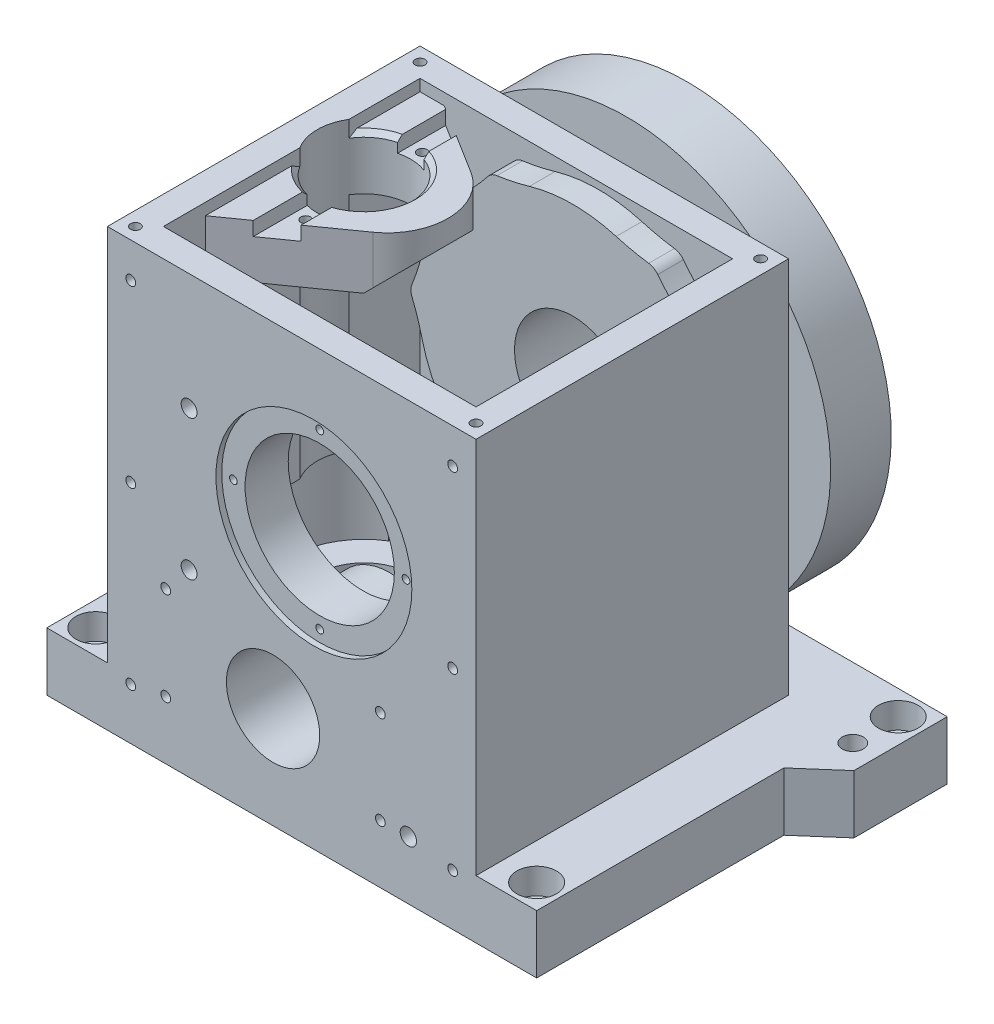
from build123d import *
from build123d.topology import SkipClean

# Parameters (mm, degrees)
SKETCH1_W             = 158
SKETCH1_H             = 187
EXTRUDE1_DEPTH        = 134
SHELL1_T              = -12
SKETCH2_R             = 87.5
EXTRUDE2_DEPTH        = 26
SKETCH3_R             = 82.5
EXTRUDE4_DEPTH        = 11
SKETCH4_R             = 75.5
EXTRUDE5_DEPTH        = 5
SKETCH5_R             = 57
EXTRUDE6_DEPTH        = 18
SKETCH6_R             = 25
EXTRUDE7_DEPTH        = 109
SKETCH8_R             = 32
EXTRUDE8_DEPTH        = 109
SKETCH41_R            = 41
SKETCH41_R_2          = 32
EXTRUDE42_DEPTH       = 9
SKETCH9_R             = 42
EXTRUDE9_DEPTH        = 2.5
CIRPATTERN7_COUNT     = 6
SKETCH10_R            = 20
EXTRUDE10_DEPTH       = 135.5
EXTRUDE12_DEPTH       = 25
EXTRUDE13_DEPTH       = 26
EXTRUDE14_DEPTH       = 45
CIRPATTERN1_COUNT     = 2
SKETCH16_R            = 4
EXTRUDE15_DEPTH       = 45
CIRPATTERN2_COUNT     = 6
SKETCH17_R            = 4
EXTRUDE16_DEPTH       = 21
SKETCH18_R            = 3
EXTRUDE17_DEPTH       = 9
CIRPATTERN3_COUNT     = 2
CIRPATTERN4_COUNT     = 2
EXTRUDE18_DEPTH       = 25
SKETCH20_R            = 8.5
EXTRUDE19_DEPTH       = 11
SKETCH21_R            = 5.5
SKETCH21_R_2          = 4.5
EXTRUDE20_DEPTH       = 255.945092128
EXTRUDE25_DEPTH       = 11
SKETCH23_R            = 20
EXTRUDE26_DEPTH       = 21
SKETCH24_R            = 25
EXTRUDE27_DEPTH       = 74
EXTRUDE28_DEPTH       = 23
EXTRUDE29_DEPTH       = 73
EXTRUDE36_DEPTH       = 74
EXTRUDE37_START       = -52
EXTRUDE37_DEPTH       = 52
EXTRUDE38_DEPTH       = 42
EXTRUDE39_DEPTH       = 154
SKETCH35_R            = 20
EXTRUDE35_DEPTH       = 239
SKETCH39_R            = 30
EXTRUDE40_DEPTH       = 7
EXTRUDE41_DEPTH       = 3
CHAMFER1_SIZE         = 3
SKETCH42_R            = 20
EXTRUDE43_DEPTH       = 38
SKETCH43_W            = 12
SKETCH43_H            = 82.49545063
EXTRUDE44_DEPTH       = 11
CUT_EXTRUDE1_START    = 50
SKETCH44_R            = 20
CUT_EXTRUDE1_DEPTH    = 50
CHAMFER2_SIZE         = 2
LPATTERN1_COUNT       = 2
LPATTERN1_PITCH       = 146
LPATTERN1_COUNT_DIR2  = 2
LPATTERN1_PITCH_DIR2  = 122
LPATTERN2_COUNT       = 3
LPATTERN2_PITCH       = 75
LPATTERN2_COUNT_DIR2  = 2
LPATTERN2_PITCH_DIR2  = 138
LPATTERN3_COUNT       = 2
LPATTERN3_PITCH       = 60
LPATTERN4_COUNT       = 2
LPATTERN4_PITCH       = 40
LPATTERN4_COUNT_DIR2  = 2
LPATTERN4_PITCH_DIR2  = 92
SKETCH52_R            = 3.5
CUT_EXTRUDE2_DEPTH    = 10
CIRPATTERN5_COUNT     = 4
CIRPATTERN6_COUNT     = 4
M5_TAPPED_HOLE6_D     = 4.2
M5_TAPPED_HOLE6_DEPTH = 34
M5_TAPPED_HOLE6_TIP   = 1.2618073
FILLET1_R             = 100
FILLET2_R             = 10
SKETCH62_R            = 8.5
CUT_EXTRUDE3_DEPTH    = 5
M5_TAPPED_HOLE9_D     = 4.2
M5_TAPPED_HOLE9_DEPTH = 52
M5_TAPPED_HOLE9_TIP   = 1.2618073


# Some blends are built 0.0001 mm under size
with BuildPart() as part:
    # Sketch1 → Extrude1 (new body)
    with BuildSketch(Plane.XY):
        Rectangle(SKETCH1_W, SKETCH1_H)
    extrude(amount=EXTRUDE1_DEPTH)

    # Shell1
    shell1_openings = [part.faces().sort_by_distance(p)[0] for p in [
        (0, 93.5, 67),
    ]]
    offset(amount=SHELL1_T, openings=shell1_openings, kind=Kind.INTERSECTION)

    # Sketch2 → Extrude2 (add)
    with BuildSketch(Plane(origin=(0, 0, 0), x_dir=(-1, 0, 0), z_dir=(0, 0, -1))):
        with Locations(Location((-9.5, 24, 0), (0, 0, 217.412158467))):
            Circle(SKETCH2_R)
    extrude(amount=EXTRUDE2_DEPTH)

    # Sketch3 → Extrude4 (cut)
    with BuildSketch(Plane(origin=(0, 0, -26), x_dir=(-1, 0, 0), z_dir=(0, 0, -1))):
        with Locations((-9.5, 24)):
            Circle(SKETCH3_R)
    extrude(amount=-EXTRUDE4_DEPTH, mode=Mode.SUBTRACT)

    # Sketch4 → Extrude5 (cut)
    with BuildSketch(Plane(origin=(0, 0, -15), x_dir=(-1, 0, 0), z_dir=(0, 0, -1))):
        with Locations((-9.5, 24)):
            Circle(SKETCH4_R)
    extrude(amount=-EXTRUDE5_DEPTH, mode=Mode.SUBTRACT)

    # Sketch5 → Extrude6 (add)
    with BuildSketch(Plane(origin=(0, 0, -10), x_dir=(-1, 0, 0), z_dir=(0, 0, -1))):
        with Locations((-9.5, 24)):
            Circle(SKETCH5_R)
    extrude(amount=EXTRUDE6_DEPTH)

    # Sketch6 → Extrude7 (cut)
    with BuildSketch(Plane(origin=(0, 0, -28), x_dir=(-1, 0, 0), z_dir=(0, 0, -1))):
        with Locations((-9.5, 24)):
            Circle(SKETCH6_R)
    extrude(amount=-EXTRUDE7_DEPTH, mode=Mode.SUBTRACT)

    # Sketch8 → Extrude8 (cut)
    with BuildSketch(Plane.XY.offset(134)):
        with Locations((9.5, 24)):
            Circle(SKETCH8_R)
    extrude(amount=-EXTRUDE8_DEPTH, mode=Mode.SUBTRACT)

    # Sketch41 → Extrude42 (add)
    with BuildSketch(Plane(origin=(0, 0, 122), x_dir=(-1, 0, 0), z_dir=(0, 0, -1))):
        with Locations(Location((-9.5, 24, 0), (0, 0, 180))):
            Circle(SKETCH41_R)
        with Locations(Location((-9.5, 24, 0), (0, 0, 180))):
            Circle(SKETCH41_R_2, mode=Mode.SUBTRACT)
    extrude(amount=EXTRUDE42_DEPTH)

    # Sketch9 → Extrude9 (cut)
    with BuildSketch(Plane.XY.offset(134)):
        with Locations((9.5, 24)):
            Circle(SKETCH9_R)
    extrude(amount=-EXTRUDE9_DEPTH, mode=Mode.SUBTRACT)

    # Sketch59 → M5 Tapped Hole7 (revolve, cut)
    with BuildSketch(Plane(origin=(72.9, 24, -10), x_dir=(0, 1, 0), z_dir=(1, 0, 0))):
        Polygon((0, 0), (0, 23.2618073), (2.1, 22), (2.1, 0), align=None)
    m5_tapped_hole7 = revolve(axis=Axis((72.9, 24, -16.35), (0, 0, 1)), mode=Mode.SUBTRACT)

    # CirPattern7: M5 Tapped Hole7 ×6 about axis
    cirpattern7_axis = Axis((9.5, 24, 0), (0, 0, 1))
    for i in range(1, CIRPATTERN7_COUNT):
        add(m5_tapped_hole7.rotate(cirpattern7_axis, i * 360 / CIRPATTERN7_COUNT), mode=Mode.SUBTRACT)

    # Sketch10 → Extrude10 (cut)
    with BuildSketch(Plane.XY.offset(134)):
        with Locations((-8, -50)):
            Circle(SKETCH10_R)
    extrude(amount=-EXTRUDE10_DEPTH, mode=Mode.SUBTRACT)

    # Sketch11 → Extrude12 (add)
    with BuildSketch(Plane.XZ.offset(93.5)):
        Polygon((105, 134), (79, 134), (79, 0), (-79, 0), (-79, 134), (-105, 134), (-105, -26), (105, -26), align=None)
    extrude(amount=-EXTRUDE12_DEPTH)

    # Sketch12 → Extrude13 (cut)
    with BuildSketch(Plane(origin=(0, 0, -26), x_dir=(-1, 0, 0), z_dir=(0, 0, -1))):
        with BuildLine():
            Line((-43.085711247, -67), (24.085711247, -67))
            ThreePointArc((24.085711247, -67), (-9.5, -73), (-43.085711247, -67))
        make_face()
    extrude(amount=-EXTRUDE13_DEPTH, mode=Mode.SUBTRACT)

    # Sketch13 → Extrude14 (cut)
    with BuildSketch(Plane(origin=(0, 0, -28), x_dir=(-1, 0, 0), z_dir=(0, 0, -1))):
        with BuildLine():
            Line((-56.5, 38.5), (-53.5, 38.5))
            Line((-53.5, 38.5), (-53.5, 32.366600265))
            ThreePointArc((-53.5, 32.366600265), (-55, 15.5), (-56.5, 32.366600265))
            Line((-56.5, 32.366600265), (-56.5, 38.5))
        make_face()
    extrude14 = extrude(amount=-EXTRUDE14_DEPTH, mode=Mode.SUBTRACT)

    # CirPattern1: Extrude14 ×2 about axis
    cirpattern1_axis = Axis((9.5, 24, 0), (0, 0, 1))
    for i in range(1, CIRPATTERN1_COUNT):
        add(extrude14.rotate(cirpattern1_axis, i * 360 / CIRPATTERN1_COUNT), mode=Mode.SUBTRACT)

    # Sketch16 → Extrude15 (cut)
    with BuildSketch(Plane(origin=(0, 0, -28), x_dir=(-1, 0, 0), z_dir=(0, 0, -1))):
        with Locations((-40.5, 24)):
            Circle(SKETCH16_R)
    extrude15 = extrude(amount=-EXTRUDE15_DEPTH, mode=Mode.SUBTRACT)

    # CirPattern2: Extrude15 ×6 about axis
    cirpattern2_axis = Axis((9.5, 24, 0), (0, 0, 1))
    for i in range(1, CIRPATTERN2_COUNT):
        add(extrude15.rotate(cirpattern2_axis, i * 360 / CIRPATTERN2_COUNT), mode=Mode.SUBTRACT)

    # Sketch17 → Extrude16 (cut)
    with BuildSketch(Plane(origin=(0, 0, -10), x_dir=(-1, 0, 0), z_dir=(0, 0, -1))):
        with Locations((-63.193575035, 55)):
            Circle(SKETCH17_R)
    extrude16 = extrude(amount=-EXTRUDE16_DEPTH, mode=Mode.SUBTRACT)

    # Sketch18 → Extrude17 (cut)
    with BuildSketch(Plane(origin=(0, 0, -10), x_dir=(-1, 0, 0), z_dir=(0, 0, -1))):
        with Locations((-63.193575035, -7)):
            Circle(SKETCH18_R)
    extrude17 = extrude(amount=-EXTRUDE17_DEPTH, mode=Mode.SUBTRACT)

    # CirPattern3: Extrude16 ×2 about axis
    cirpattern3_axis = Axis((9.5, 24, 0), (0, 0, 1))
    for i in range(1, CIRPATTERN3_COUNT):
        add(extrude16.rotate(cirpattern3_axis, i * 360 / CIRPATTERN3_COUNT), mode=Mode.SUBTRACT)

    # CirPattern4: Extrude17 ×2 about axis
    cirpattern4_axis = Axis((9.5, 24, 0), (0, 0, 1))
    for i in range(1, CIRPATTERN4_COUNT):
        add(extrude17.rotate(cirpattern4_axis, i * 360 / CIRPATTERN4_COUNT), mode=Mode.SUBTRACT)

    # Sketch19 → Extrude18 (add)
    with BuildSketch(Plane(origin=(0, -68.5, 0), x_dir=(1, 0, 0), z_dir=(0, 1, 0))):
        Polygon((105, -28), (105, 26), (121, 26), (121, -14), align=None)
    extrude(amount=-EXTRUDE18_DEPTH)

    # Sketch20 → Extrude19 (cut)
    with BuildSketch(Plane(origin=(0, -68.5, 0), x_dir=(1, 0, 0), z_dir=(0, 1, 0))):
        with Locations(Location((-94.5, -123.5, 0), (0, 0, 180))):
            Circle(SKETCH20_R)
        with Locations(Location((-94.5, 15.5, 0), (0, 0, 180))):
            Circle(SKETCH20_R)
        with Locations(Location((110.5, 15.5, 0), (0, 0, 180))):
            Circle(SKETCH20_R)
        with Locations(Location((94.5, -123.5, 0), (0, 0, 180))):
            Circle(SKETCH20_R)
    extrude(amount=-EXTRUDE19_DEPTH, mode=Mode.SUBTRACT)

    # Sketch21 → Extrude20 (cut, through all)
    with BuildSketch(Plane(origin=(0, -68.5, 0), x_dir=(1, 0, 0), z_dir=(0, 1, 0))):
        with Locations(Location((-94.5, 15.5, 0), (0, 0, 180))):
            Circle(SKETCH21_R)
        with Locations(Location((-94.5, -123.5, 0), (0, 0, 180))):
            Circle(SKETCH21_R)
        with Locations(Location((94.5, -123.5, 0), (0, 0, 180))):
            Circle(SKETCH21_R)
        with Locations(Location((110.5, 15.5, 0), (0, 0, 180))):
            Circle(SKETCH21_R)
        with Locations(Location((110.5, -4, 0), (0, 0, 180))):
            Circle(SKETCH21_R_2)
    extrude(amount=-EXTRUDE20_DEPTH, mode=Mode.SUBTRACT)

    # Sketch22 → Extrude25 (add)
    with BuildSketch(Plane.XY.offset(12)):
        with BuildLine():
            Line((67, 57.406586177), (67, -9.406586177))
            ThreePointArc((67, -9.406586177), (58.284474247, -21.192090817), (47.198716285, -30.781902034))
            ThreePointArc((47.198716285, -30.781902034), (44.2, -36.102163023), (38.093160687, -36.03899701))
            ThreePointArc((38.093160687, -36.03899701), (34.323305633, -37.693220839), (30.458315313, -39.111005532))
            ThreePointArc((30.458315313, -39.111005532), (29.992421312, -62.417251713), (16.604109764, -81.5))
            Line((16.604109764, -81.5), (-32.604109764, -81.5))
            ThreePointArc((-32.604109764, -81.5), (-47.830312702, -53.340420239), (-37.507091516, -23.038105268))
            ThreePointArc((-37.507091516, -23.038105268), (-50.878616002, -3.868848732), (-56.791876972, 18.742905025))
            ThreePointArc((-56.791876972, 18.742905025), (-59.9, 24), (-56.791876972, 29.257094975))
            ThreePointArc((-56.791876972, 29.257094975), (-48.090689352, 57.25), (-28.198716285, 78.781902034))
            ThreePointArc((-28.198716285, 78.781902034), (-25.2, 84.102163023), (-19.093160687, 84.03899701))
            ThreePointArc((-19.093160687, 84.03899701), (9.5, 90.5), (38.093160687, 84.03899701))
            ThreePointArc((38.093160687, 84.03899701), (44.2, 84.102163023), (47.198716285, 78.781902034))
            ThreePointArc((47.198716285, 78.781902034), (58.284474247, 69.192090817), (67, 57.406586177))
        make_face()
    extrude(amount=EXTRUDE25_DEPTH)

    # Sketch23 → Extrude26 (cut)
    with BuildSketch(Plane.XY.offset(23)):
        with Locations((-8, -50)):
            Circle(SKETCH23_R)
    extrude(amount=-EXTRUDE26_DEPTH, mode=Mode.SUBTRACT)

    # Sketch24 → Extrude27 (cut)
    with BuildSketch(Plane(origin=(0, 0, 12), x_dir=(-1, 0, 0), z_dir=(0, 0, -1))):
        with Locations((-9.5, 24)):
            Circle(SKETCH24_R)
    extrude(amount=-EXTRUDE27_DEPTH, mode=Mode.SUBTRACT)

    # Sketch25 → Extrude28 (add)
    with BuildSketch(Plane(origin=(0, 88.5, 0), x_dir=(-1, 0, 0), z_dir=(0, 1, 0))):
        with BuildLine():
            Line((67, 104), (24.967109486, 74.213491056))
            ThreePointArc((24.967109486, 74.213491056), (14.011240695, 52.235546082), (26.240002757, 30.939572174))
            Line((26.240002757, 30.939572174), (56.604475775, 12))
            Line((56.604475775, 12), (67, 12))
            Line((67, 12), (67, 42.464346247))
            ThreePointArc((67, 42.464346247), (30, 53), (67, 63.535653753))
            Line((67, 63.535653753), (67, 104))
        make_face()
    extrude(amount=-EXTRUDE28_DEPTH)

    # Sketch26 → Extrude29 (cut)
    with BuildSketch(Plane.XY.offset(97)):
        Polygon((-14.30151519, 78.5), (-44, 48.80151519), (-10.402265951, 48.80151519), (-10.402265951, 82.399249239), align=None)
    extrude(amount=-EXTRUDE29_DEPTH, mode=Mode.SUBTRACT)

    # Sketch28 → Extrude36 (add)
    with BuildSketch(Plane.XZ.offset(93.5)):
        with BuildLine():
            Line((-50, 83), (-79, 83))
            ThreePointArc((-79, 83), (-91.72529209, 53), (-79, 23))
            Line((-79, 23), (-50, 23))
            ThreePointArc((-50, 23), (-20, 53), (-50, 83))
        make_face()
    extrude(amount=-EXTRUDE36_DEPTH)

    # Sketch36 → Extrude37 (cut)
    with BuildSketch(Plane(origin=(0, -19.5, 0), x_dir=(1, 0, 0), z_dir=(0, 1, 0)).offset(EXTRUDE37_START)):
        with BuildLine():
            Line((-50, -23), (-67, -23))
            Line((-67, -23), (-67, -83))
            Line((-67, -83), (-50, -83))
            ThreePointArc((-50, -83), (-20, -53), (-50, -23))
        make_face()
    extrude(amount=EXTRUDE37_DEPTH, mode=Mode.SUBTRACT)

    # Sketch37 → Extrude38 (cut)
    with BuildSketch(Plane(origin=(0, -71.5, 0), x_dir=(1, 0, 0), z_dir=(0, 1, 0))):
        with BuildLine():
            Line((-50, -23), (-50, -83))
            Line((-50, -83), (-62.047272497, -83))
            ThreePointArc((-62.047272497, -83), (-82.328575202, -53), (-62.047272497, -23))
            Line((-62.047272497, -23), (-50, -23))
        make_face()
    extrude(amount=EXTRUDE38_DEPTH, mode=Mode.SUBTRACT)

    # Sketch38 → Extrude39 (cut)
    with BuildSketch(Plane.XY.offset(134)):
        Polygon((-79, -19.5), (-97.669801307, -38.169801307), (-97.669801307, -9.903731157), align=None)
    extrude(amount=-EXTRUDE39_DEPTH, mode=Mode.SUBTRACT)

    # Sketch35 → Extrude35 (cut)
    with SkipClean():  # the faces are left unmerged after this step: merging them gives an invalid solid
        with BuildSketch(Plane(origin=(0, 88.5, 0), x_dir=(1, 0, 0), z_dir=(0, 1, 0))):
            with Locations(Location((-50, -53, 0), (0, 0, 148.211669383))):
                Circle(SKETCH35_R)
        extrude(amount=-EXTRUDE35_DEPTH, mode=Mode.SUBTRACT)

    # Sketch39 → Extrude40 (cut)
    with SkipClean():  # the faces are left unmerged after this step: merging them gives an invalid solid
        with BuildSketch(Plane.XZ.offset(93.5)):
            with Locations((-50, 53)):
                Circle(SKETCH39_R)
        extrude(amount=-EXTRUDE40_DEPTH, mode=Mode.SUBTRACT)

    # Sketch40 → Extrude41 (cut)
    with SkipClean():  # the faces are left unmerged after this step: merging them gives an invalid solid
        with BuildSketch(Plane.XZ.offset(93.5)):
            with BuildLine():
                Line((-70, 117), (75, 117))
                Line((75, 117), (75, 7))
                Line((75, 7), (-50, 7))
                Line((-50, 7), (-50, 13))
                ThreePointArc((-50, 13), (-10, 53), (-50, 93))
                Line((-50, 93), (-70, 93))
                Line((-70, 93), (-70, 117))
            make_face()
        extrude(amount=-EXTRUDE41_DEPTH, mode=Mode.SUBTRACT)

    # Chamfer1
    chamfer1_edges = [part.edges().sort_by_distance(p)[0] for p in [
        (2.5, -90.5, 117),
        (75, -90.5, 62),
        (12.5, -90.5, 7),
        (-50, -90.5, 10),
        (-10, -90.5, 53),
        (-60, -90.5, 93),
        (-70, -90.5, 105),
    ]]
    chamfer(chamfer1_edges, length=CHAMFER1_SIZE - 0.0001)  # a hair under: the kernel refuses the full size

    # Sketch42 → Extrude43 (add)
    with BuildSketch(Plane(origin=(0, 0, 122), x_dir=(-1, 0, 0), z_dir=(0, 0, -1))):
        with BuildLine():
            Line((-17.5, -50), (-17.5, -81.5))
            Line((-17.5, -81.5), (33.5, -81.5))
            Line((33.5, -81.5), (33.5, -50))
            ThreePointArc((33.5, -50), (8, -24.5), (-17.5, -50))
        make_face()
        with Locations(Location((8, -50, 0), (0, 0, 180))):
            Circle(SKETCH42_R, mode=Mode.SUBTRACT)
    extrude(amount=EXTRUDE43_DEPTH)

    # Sketch43 → Extrude44 (cut)
    with BuildSketch(Plane(origin=(0, 93.5, 0), x_dir=(1, 0, 0), z_dir=(0, 1, 0))):
        with Locations((-49, -54.248502925)):
            Rectangle(SKETCH43_W, SKETCH43_H)
    extrude(amount=-EXTRUDE44_DEPTH, mode=Mode.SUBTRACT)

    # Sketch44 → Cut-Extrude1 (cut)
    with BuildSketch(Plane(origin=(0, 82.5, 0), x_dir=(1, 0, 0), z_dir=(0, 1, 0)).offset(CUT_EXTRUDE1_START)):
        with Locations(Location((-50, -53, 0), (0, 0, 180))):
            Circle(SKETCH44_R)
    extrude(amount=-CUT_EXTRUDE1_DEPTH, mode=Mode.SUBTRACT)

    # Chamfer2
    # the kernel refuses this chamfer: 2 mm, written as the material it takes off along each edge
    with BuildSketch(Plane(origin=(-50, 88.5, 53), x_dir=(-0.956037606073061, 0, -0.2932440890693121), z_dir=(-0.2932440890693121, 0, 0.956037606073061))) as chamfer2_piece_1_section:
        Polygon((20 + CHAMFER2_SIZE, 0), (20, CHAMFER2_SIZE), (20, 0), align=None)
    chamfer2_piece_1 = revolve(axis=Axis((-50, 88.5, 53), (0, -1, 0)), revolution_arc=73.206268245, mode=Mode.PRIVATE)
    chamfer2_piece_1 = split(chamfer2_piece_1, bisect_by=Plane(origin=(-67, 87.524998856, 34.674080868), z_dir=(1, 0, 0)), keep=Keep.TOP, mode=Mode.PRIVATE)
    add(chamfer2_piece_1, mode=Mode.SUBTRACT)
    with BuildSketch(Plane(origin=(-50, 88.5, 53), x_dir=(0.09998883571876681, 0, -0.9949885590958347), z_dir=(-0.9949885590958347, 0, -0.09998883571876681))) as chamfer2_piece_2:
        Polygon((20 + CHAMFER2_SIZE, 0), (20, CHAMFER2_SIZE), (20, 0), align=None)
    revolve(axis=Axis((-50, 88.5, 53), (0, -1, 0)), revolution_arc=168.522944822, mode=Mode.SUBTRACT)
    with BuildSketch(Plane(origin=(-50, 88.5, 53), x_dir=(0.0045124171902632074, 0, 0.9999898189937241), z_dir=(0.9999898189937241, 0, -0.0045124171902632074))) as chamfer2_piece_3_section:
        Polygon((20 + CHAMFER2_SIZE, 0), (20, CHAMFER2_SIZE), (20, 0), align=None)
    chamfer2_piece_3 = revolve(axis=Axis((-50, 88.5, 53), (0, -1, 0)), revolution_arc=73.206268245, mode=Mode.PRIVATE)
    chamfer2_piece_3 = split(chamfer2_piece_3, bisect_by=Plane(origin=(-67, 87.524998859, 71.325919129), z_dir=(1, 0, 0)), keep=Keep.TOP, mode=Mode.PRIVATE)
    add(chamfer2_piece_3, mode=Mode.SUBTRACT)

    # Sketch46 → M5 Tapped Hole1 (revolve, cut)
    with BuildSketch(Plane(origin=(-73, 93.5, 6), x_dir=(0, 0, 1), z_dir=(1, 0, 0))):
        Polygon((0, 0), (0, 15.2618073), (2.1, 14), (2.1, 0), align=None)
    m5_tapped_hole1 = revolve(axis=Axis((-73, 99.85, 6), (0, -1, 0)), mode=Mode.SUBTRACT)

    # LPattern1: M5 Tapped Hole1 2 × 2
    with Locations(*[(i * LPATTERN1_PITCH, 0, j * LPATTERN1_PITCH_DIR2) for i in range(LPATTERN1_COUNT) for j in range(LPATTERN1_COUNT_DIR2) if (i, j) != (0, 0)]):
        add(m5_tapped_hole1, mode=Mode.SUBTRACT)

    # Sketch48 → M5 Tapped Hole2 (revolve, cut)
    with BuildSketch(Plane(origin=(-69, 78.5, 134), x_dir=(0, -1, 0), z_dir=(1, 0, 0))):
        Polygon((0, 0), (0, 10.2618073), (2.1, 9), (2.1, 0), align=None)
    m5_tapped_hole2 = revolve(axis=Axis((-69, 78.5, 140.35), (0, 0, -1)), mode=Mode.SUBTRACT)

    # LPattern2: M5 Tapped Hole2 3 × 2
    with Locations(*[(j * LPATTERN2_PITCH_DIR2, -i * LPATTERN2_PITCH, 0) for i in range(LPATTERN2_COUNT) for j in range(LPATTERN2_COUNT_DIR2) if (i, j) != (0, 0)]):
        add(m5_tapped_hole2, mode=Mode.SUBTRACT)

    # Sketch49 → M8 Tapped Hole1 (revolve, cut)
    with BuildSketch(Plane(origin=(-44, 43.5, 134), x_dir=(0, -1, 0), z_dir=(1, 0, 0))):
        Polygon((0, 0), (0, 10.042926105), (3.4, 8), (3.4, 0), align=None)
    m8_tapped_hole1 = revolve(axis=Axis((-44, 43.5, 140.35), (0, 0, -1)), mode=Mode.SUBTRACT)

    # LPattern3: M8 Tapped Hole1 ×2
    with Locations(*[(0, -i * LPATTERN3_PITCH, 0) for i in range(1, LPATTERN3_COUNT)]):
        add(m8_tapped_hole1, mode=Mode.SUBTRACT)

    # Sketch50 → M5 Tapped Hole3 (revolve, cut)
    with BuildSketch(Plane(origin=(-54, -68.5, 134), x_dir=(0, -1, 0), z_dir=(1, 0, 0))):
        Polygon((0, 0), (0, 10.2618073), (2.1, 9), (2.1, 0), align=None)
    m5_tapped_hole3 = revolve(axis=Axis((-54, -68.5, 140.35), (0, 0, -1)), mode=Mode.SUBTRACT)

    # LPattern4: M5 Tapped Hole3 2 × 2
    with Locations(*[(j * LPATTERN4_PITCH_DIR2, i * LPATTERN4_PITCH, 0) for i in range(LPATTERN4_COUNT) for j in range(LPATTERN4_COUNT_DIR2) if (i, j) != (0, 0)]):
        add(m5_tapped_hole3, mode=Mode.SUBTRACT)

    # Sketch52 → Cut-Extrude2 (cut)
    with BuildSketch(Plane.XY.offset(134)):
        with Locations((50, -68.5)):
            Circle(SKETCH52_R)
    extrude(amount=-CUT_EXTRUDE2_DEPTH, mode=Mode.SUBTRACT)

    # Sketch54 → M4 Tapped Hole1 (revolve, cut)
    with BuildSketch(Plane(origin=(9.5, 61, 131.5), x_dir=(0, -1, 0), z_dir=(1, 0, 0))):
        Polygon((0, 0), (0, 10.991420021), (1.65, 10), (1.65, 0), align=None)
    m4_tapped_hole1 = revolve(axis=Axis((9.5, 61, 137.85), (0, 0, -1)), mode=Mode.SUBTRACT)

    # CirPattern5: M4 Tapped Hole1 ×4 about axis
    cirpattern5_axis = Axis((9.5, 24, 0), (0, 0, 1))
    for i in range(1, CIRPATTERN5_COUNT):
        add(m4_tapped_hole1.rotate(cirpattern5_axis, i * 360 / CIRPATTERN5_COUNT), mode=Mode.SUBTRACT)

    # Sketch57 → M5 Tapped Hole5 (revolve, cut)
    with BuildSketch(Plane(origin=(-25, -86.5, 53), x_dir=(0, 0, -1), z_dir=(1, 0, 0))):
        Polygon((0, 0), (0, 35.2618073), (2.1, 34), (2.1, 0), align=None)
    m5_tapped_hole5 = revolve(axis=Axis((-25, -92.85, 53), (0, 1, 0)), mode=Mode.SUBTRACT)

    # CirPattern6: M5 Tapped Hole5 ×4 about axis
    cirpattern6_axis = Axis((-50, 0, 53), (0, 1, 0))
    for i in range(1, CIRPATTERN6_COUNT):
        add(m5_tapped_hole5.rotate(cirpattern6_axis, i * 360 / CIRPATTERN6_COUNT), mode=Mode.SUBTRACT)

    # M5 Tapped Hole6
    with Locations(Plane(origin=(-50, 82.5, 78), x_dir=(0, 0, 1), z_dir=(0, 1, 0))):
        with Locations((0, 0), (-50, 0)):
            Hole(M5_TAPPED_HOLE6_D / 2, depth=M5_TAPPED_HOLE6_DEPTH)
            with Locations((0, 0, -(M5_TAPPED_HOLE6_DEPTH + M5_TAPPED_HOLE6_TIP / 2))):  # 118° drill point
                Cone(0, M5_TAPPED_HOLE6_D / 2, M5_TAPPED_HOLE6_TIP, mode=Mode.SUBTRACT)

    # Fillet1
    # the kernel refuses this fillet: 100 mm, written as the material it adds along each edge
    with BuildSketch(Plane(origin=(-56.791876972, 18.742905025, -14.75667587), x_dir=(0.1590170395711563, -0.9872758384190434, 0), z_dir=(0, 0, 1))) as fillet1_piece_1_section:
        with BuildLine():
            CenterArc((18.749790911, -99.675693379), FILLET1_R, 94.615651155, 8.182129044)
            ThreePointArc((-3.40128083, -2.15989968), (-1.513918182, -1.373988846), (0, 0))
            ThreePointArc((0, 0), (5.351335174, -0.215663903), (10.702670348, 0))
        make_face()
    fillet1_piece_1 = extrude(amount=37.75667587, mode=Mode.PRIVATE)
    fillet1_piece_1 = split(fillet1_piece_1, bisect_by=Plane(origin=(-57.186043836, 16.759713821, -10), z_dir=(0, 0, 1)), keep=Keep.TOP, mode=Mode.PRIVATE)
    add(fillet1_piece_1)
    with BuildSketch(Plane(origin=(38.093160687, -36.03899701, -8.574270983), x_dir=(-0.9277176065975381, -0.37328279147174154, 0), z_dir=(0, 0, 1))) as fillet1_piece_2:
        with BuildLine():
            CenterArc((21.238973975, 99.15018411), FILLET1_R, 255.780642783, 6.744410645)
            ThreePointArc((-3.32451565, 2.213942294), (-1.4726217, 1.391733882), (0, 0))
            ThreePointArc((0, 0), (4.114854197, 0.127430553), (8.229708393, 0))
        make_face()
    extrude(amount=31.574270983)
    with BuildSketch(Plane(origin=(47.198716285, -30.781902034, -14.75667587), x_dir=(0.7754974368278958, 0.6313507151127363, 0), z_dir=(0, 0, 1))) as fillet1_piece_3_section:
        with BuildLine():
            CenterArc((18.749790911, -99.675693379), FILLET1_R, 94.615651155, 8.182129044)
            ThreePointArc((-3.40128083, -2.15989968), (-1.513918182, -1.373988846), (0, 0))
            ThreePointArc((0, 0), (5.351335174, -0.215663903), (10.702670348, 0))
        make_face()
    fillet1_piece_3 = extrude(amount=37.75667587, mode=Mode.PRIVATE)
    fillet1_piece_3 = split(fillet1_piece_3, bisect_by=Plane(origin=(49.113293679, -30.13166495, -10), z_dir=(0, 0, 1)), keep=Keep.TOP, mode=Mode.PRIVATE)
    add(fillet1_piece_3)
    with BuildSketch(Plane(origin=(47.198716285, 78.781902034, -14.75667587), x_dir=(-0.31620493147041706, 0.9486909092606446, 0), z_dir=(0, 0, 1))) as fillet1_piece_4_section:
        with BuildLine():
            CenterArc((37.605201009, -94.1947311), FILLET1_R, 109.618803767, 8.182129044)
            ThreePointArc((-9.034903172, -5.737392897), (-4.401840388, -3.050754048), (0, 0))
            ThreePointArc((0, 0), (2.01456434, -0.348316134), (4.029128679, 0))
        make_face()
    fillet1_piece_4 = extrude(amount=37.75667587, mode=Mode.PRIVATE)
    fillet1_piece_4 = split(fillet1_piece_4, bisect_by=Plane(origin=(49.113293679, 78.13166495, -10), z_dir=(0, 0, 1)), keep=Keep.TOP, mode=Mode.PRIVATE)
    add(fillet1_piece_4)
    with BuildSketch(Plane(origin=(38.093160687, 84.03899701, -14.75667587), x_dir=(-0.9345144763990467, 0.3559251233063151, 0), z_dir=(0, 0, 1))) as fillet1_piece_5_section:
        with BuildLine():
            CenterArc((18.749790911, -99.675693379), FILLET1_R, 94.615651155, 8.182129044)
            ThreePointArc((-3.40128083, -2.15989968), (-1.513918182, -1.373988846), (0, 0))
            ThreePointArc((0, 0), (5.351335174, -0.215663903), (10.702670348, 0))
        make_face()
    fillet1_piece_5 = extrude(amount=37.75667587, mode=Mode.PRIVATE)
    fillet1_piece_5 = split(fillet1_piece_5, bisect_by=Plane(origin=(36.572750156, 85.371951129, -10), z_dir=(0, 0, 1)), keep=Keep.TOP, mode=Mode.PRIVATE)
    add(fillet1_piece_5)
    with BuildSketch(Plane(origin=(-19.093160687, 84.03899701, -14.75667587), x_dir=(-0.9796928934942869, 0.20050395117501243, 0), z_dir=(0, 0, 1))) as fillet1_piece_6_section:
        with BuildLine():
            CenterArc((37.605201009, -94.1947311), FILLET1_R, 109.618803767, 8.182129044)
            ThreePointArc((-9.034903172, -5.737392897), (-4.401840388, -3.050754048), (0, 0))
            ThreePointArc((0, 0), (2.01456434, -0.348316134), (4.029128679, 0))
        make_face()
    fillet1_piece_6 = extrude(amount=37.75667587, mode=Mode.PRIVATE)
    fillet1_piece_6 = split(fillet1_piece_6, bisect_by=Plane(origin=(-17.572750156, 85.371951129, -10), z_dir=(0, 0, 1)), keep=Keep.TOP, mode=Mode.PRIVATE)
    add(fillet1_piece_6)
    with BuildSketch(Plane(origin=(-28.198716285, 78.781902034, -14.75667587), x_dir=(-0.7754974368279022, -0.6313507151127288, 0), z_dir=(0, 0, 1))) as fillet1_piece_7_section:
        with BuildLine():
            CenterArc((18.749790911, -99.675693379), FILLET1_R, 94.615651155, 8.182129044)
            ThreePointArc((-3.40128083, -2.15989968), (-1.513918182, -1.373988846), (0, 0))
            ThreePointArc((0, 0), (5.351335174, -0.215663903), (10.702670348, 0))
        make_face()
    fillet1_piece_7 = extrude(amount=37.75667587, mode=Mode.PRIVATE)
    fillet1_piece_7 = split(fillet1_piece_7, bisect_by=Plane(origin=(-30.113293679, 78.13166495, -10), z_dir=(0, 0, 1)), keep=Keep.TOP, mode=Mode.PRIVATE)
    add(fillet1_piece_7)
    with BuildSketch(Plane(origin=(-56.791876972, 29.257094975, -14.75667587), x_dir=(-0.6634879620238575, -0.7481869580856301, 0), z_dir=(0, 0, 1))) as fillet1_piece_8_section:
        with BuildLine():
            CenterArc((37.605201009, -94.1947311), FILLET1_R, 109.618803767, 8.182129044)
            ThreePointArc((-9.034903172, -5.737392897), (-4.401840388, -3.050754048), (0, 0))
            ThreePointArc((0, 0), (2.01456434, -0.348316134), (4.029128679, 0))
        make_face()
    fillet1_piece_8 = extrude(amount=37.75667587, mode=Mode.PRIVATE)
    fillet1_piece_8 = split(fillet1_piece_8, bisect_by=Plane(origin=(-57.186043836, 31.240286179, -10), z_dir=(0, 0, 1)), keep=Keep.TOP, mode=Mode.PRIVATE)
    add(fillet1_piece_8)

    # Fillet2
    fillet2_edges = [part.edges().sort_by_distance(p)[0] for p in [
        (30.458315313, -39.111005532, 17.5),
    ]]
    fillet(fillet2_edges, radius=FILLET2_R)

    # Sketch62 → Cut-Extrude3 (cut)
    with BuildSketch(Plane(origin=(0, 0, 12), x_dir=(-1, 0, 0), z_dir=(0, 0, -1))):
        with Locations((-55, 24)):
            Circle(SKETCH62_R)
        with Locations((36, 24)):
            Circle(SKETCH62_R)
    extrude(amount=-CUT_EXTRUDE3_DEPTH, mode=Mode.SUBTRACT)

    # M5 Tapped Hole9
    with Locations(Plane(origin=(0, 93.5, 0), x_dir=(-1, 0, 0), z_dir=(0, 1, 0))):
        with Locations((-9.5, 117.5)):
            Hole(M5_TAPPED_HOLE9_D / 2, depth=M5_TAPPED_HOLE9_DEPTH)
            with Locations((0, 0, -(M5_TAPPED_HOLE9_DEPTH + M5_TAPPED_HOLE9_TIP / 2))):  # 118° drill point
                Cone(0, M5_TAPPED_HOLE9_D / 2, M5_TAPPED_HOLE9_TIP, mode=Mode.SUBTRACT)


solid = part.part
